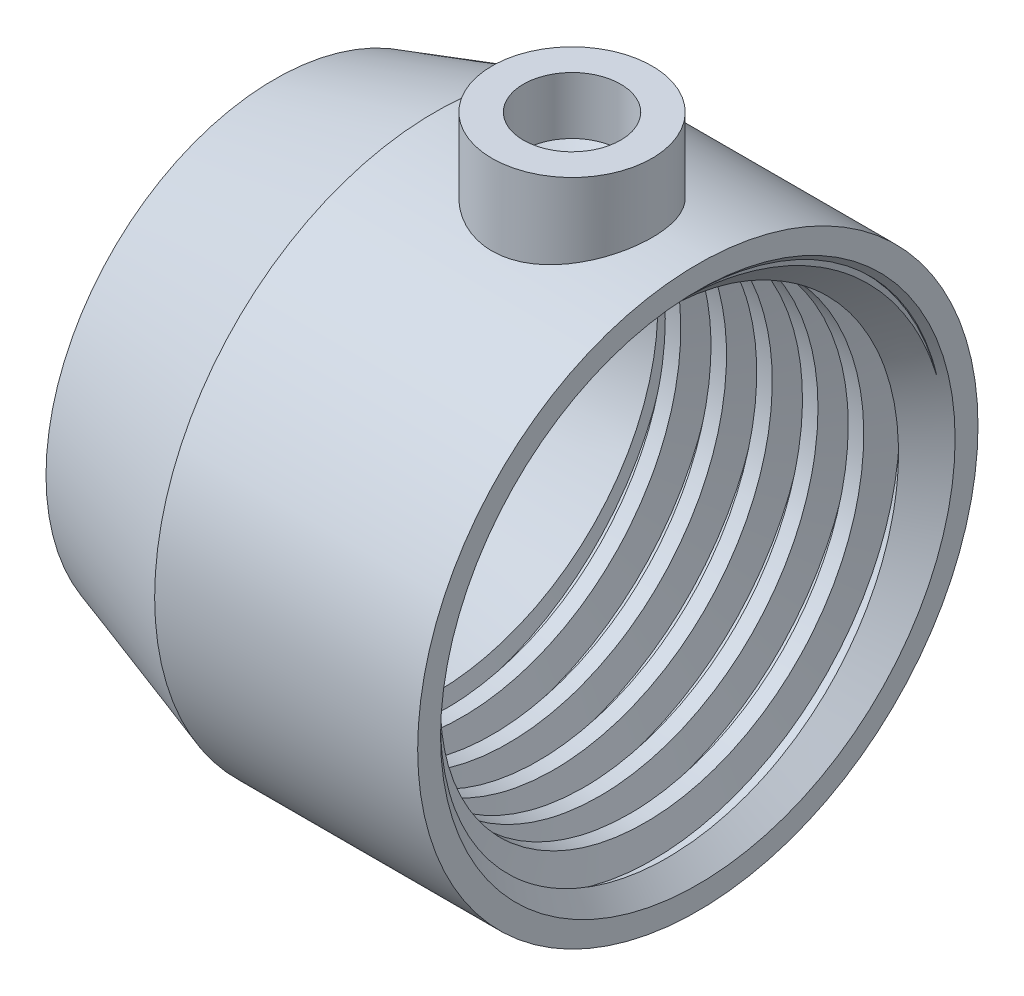
from build123d import *

# Parameters (mm, degrees)
CHAMFER1_SIZE              = 3
CUT_SWEEP1_PITCH           = 4
BOSS_EXTRUDE1_REACH        = 72.67
BOSS_EXTRUDE1_END_RADIUS   = 24.5
SKETCH8_R                  = 7
M10X1_5_TAPPED_HOLE1_D     = 8.5
M10X1_5_TAPPED_HOLE1_DEPTH = 5
M10X1_5_TAPPED_HOLE1_TIP   = 2.553657631


with BuildPart() as part:
    # Sketch1 → Revolve1 (revolve)
    with BuildSketch(Plane.XY, mode=Mode.PRIVATE) as revolve1_sk:
        Polygon((0, 13.5), (0, 20), (14, 24.5), (37, 24.5), (37, 19.5), (14, 19.5), (3, 15.964285714), (3, 13.5), align=None)
    revolve(revolve1_sk.sketch.rotate(Axis((0, 0, 0), (1, 0, 0)), 90), axis=Axis((0, 0, 0), (1, 0, 0)))

    # Chamfer1
    chamfer1_edges = [part.edges().sort_by_distance(p)[0] for p in [
        (37, 0, -19.5),
    ]]
    chamfer(chamfer1_edges, length=CHAMFER1_SIZE)

    # Cut-Sweep1: arcs per turn and ends read off the stored shape
    # Cut-Sweep1: the profile of Sketch7 profile screwed along a left-hand helix through 6.5 turns, 12 arcs to a turn; built about Z, then put on its axis
    cut_sweep1_z = Axis((0, 0, 0), (0, 0, 1))
    cut_sweep1_corners = [(19.4997, 0, 7.7585e-05), (19.4997, 0, -2.643165507), (22, 0, -1.996543961), (22, 0, -0.646543961)]
    with BuildLine(mode=Mode.PRIVATE) as cut_sweep1_profile:
        Line(cut_sweep1_corners[0], cut_sweep1_corners[1])
        Line(cut_sweep1_corners[1], cut_sweep1_corners[2])
        Line(cut_sweep1_corners[2], cut_sweep1_corners[3])
        Line(cut_sweep1_corners[3], cut_sweep1_corners[0])
    cut_sweep1_cap = Face(cut_sweep1_profile.wire())
    cut_sweep1_turn_angles = [0, -15, -30, -45, -60, -75, -90, -105, -120, -135, -150, -165, -180, -195, -210, -225, -240, -255, -270, -285, -300, -315, -330, -345, -360]
    cut_sweep1_turn_weights = [1, 0.9659258262890683, 1, 0.9659258262890683, 1, 0.9659258262890683, 1, 0.9659258262890683, 1, 0.9659258262890683, 1, 0.9659258262890683, 1, 0.9659258262890683, 1, 0.9659258262890683, 1, 0.9659258262890683, 1, 0.9659258262890683, 1, 0.9659258262890683, 1, 0.9659258262890683, 1]
    cut_sweep1_turn_rails = [Edge.make_bspline([Vector(p[0], p[1], 0).rotate(cut_sweep1_z, cut_sweep1_turn_angles[k]) / cut_sweep1_turn_weights[k] + Vector(0, 0, p[2] + -CUT_SWEEP1_PITCH * cut_sweep1_turn_angles[k] / 360) for k in range(25)], [0, 0, 0, 1, 1, 2, 2, 3, 3, 4, 4, 5, 5, 6, 6, 7, 7, 8, 8, 9, 9, 10, 10, 11, 11, 12, 12, 12], 2, cut_sweep1_turn_weights) for p in cut_sweep1_corners]
    cut_sweep1_turn_sides = [Face.make_surface_from_curves(cut_sweep1_turn_rails[p[0]], cut_sweep1_turn_rails[p[1]]) for p in [(0, 1), (1, 2), (2, 3), (3, 0)]]
    cut_sweep1_last_angles = [-2160, -2175, -2190, -2205, -2220, -2235, -2250, -2265, -2280, -2295, -2310, -2325, -2340]
    cut_sweep1_last_weights = [1, 0.9659258262890683, 1, 0.9659258262890683, 1, 0.9659258262890683, 1, 0.9659258262890683, 1, 0.9659258262890683, 1, 0.9659258262890683, 1]
    cut_sweep1_last_rails = [Edge.make_bspline([Vector(p[0], p[1], 0).rotate(cut_sweep1_z, cut_sweep1_last_angles[k]) / cut_sweep1_last_weights[k] + Vector(0, 0, p[2] + -CUT_SWEEP1_PITCH * cut_sweep1_last_angles[k] / 360) for k in range(13)], [0, 0, 0, 1, 1, 2, 2, 3, 3, 4, 4, 5, 5, 6, 6, 6], 2, cut_sweep1_last_weights) for p in cut_sweep1_corners]
    cut_sweep1_last_sides = [Face.make_surface_from_curves(cut_sweep1_last_rails[p[0]], cut_sweep1_last_rails[p[1]]) for p in [(0, 1), (1, 2), (2, 3), (3, 0)]]
    cut_sweep1 = Plane(origin=(37, 0, 0), x_dir=(0, -1, 0), z_dir=(-1, 0, 0)) * Solid(Shell([*[p.moved(Location((0, 0, CUT_SWEEP1_PITCH * i))) for i in range(6) for p in cut_sweep1_turn_sides], *cut_sweep1_last_sides, cut_sweep1_cap, cut_sweep1_cap.rotate(cut_sweep1_z, -2340).moved(Location((0, 0, -CUT_SWEEP1_PITCH * -2340 / 360)))]))
    add(cut_sweep1, mode=Mode.SUBTRACT)

    # Boss-Extrude1: up to this cylinder (the profile starts outside it)
    boss_extrude1_end = Plane(origin=(26, 0, 0), z_dir=(-1, 0, 0)) * Cylinder(BOSS_EXTRUDE1_END_RADIUS, 195.34, mode=Mode.PRIVATE)
    # Sketch8 → Boss-Extrude1 (add, up to the surface)
    with BuildSketch(Plane(origin=(0, 30.5, 0), x_dir=(1, 0, 0), z_dir=(0, 1, 0)), mode=Mode.PRIVATE) as boss_extrude1_sk1:
        with Locations(Location((26, 0, 0), (0, 0, 270))):
            Circle(SKETCH8_R)
    boss_extrude1_tool1 = extrude(boss_extrude1_sk1.sketch, amount=-BOSS_EXTRUDE1_REACH, mode=Mode.PRIVATE) - boss_extrude1_end
    add(boss_extrude1_tool1.solids().sort_by_distance((26, 30.5, 0))[0])

    # M10x1.5 Tapped Hole1
    with Locations(Plane(origin=(0, 30.5, 0), x_dir=(1, 0, 0), z_dir=(0, 1, 0))):
        with Locations((26, 0)):
            Hole(M10X1_5_TAPPED_HOLE1_D / 2, depth=M10X1_5_TAPPED_HOLE1_DEPTH)
            with Locations((0, 0, -(M10X1_5_TAPPED_HOLE1_DEPTH + M10X1_5_TAPPED_HOLE1_TIP / 2))):  # 118° drill point
                Cone(0, M10X1_5_TAPPED_HOLE1_D / 2, M10X1_5_TAPPED_HOLE1_TIP, mode=Mode.SUBTRACT)


solid = part.part
